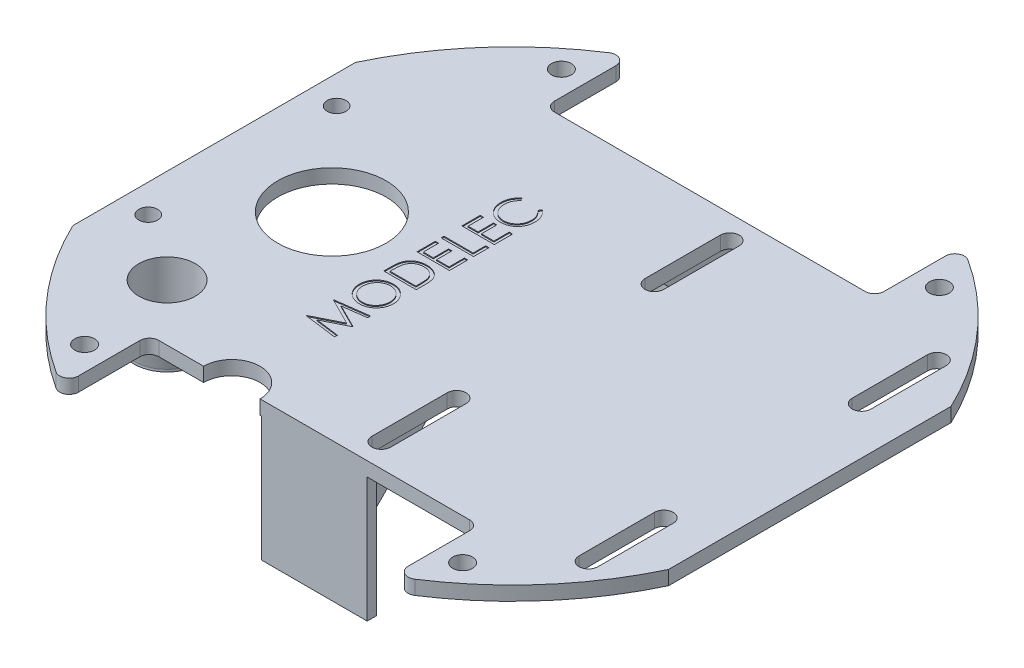
from build123d import *

# Parameters (mm, degrees)
ESQUISSE1_R                  = 2.1
ESQUISSE1_R_2                = 11.5
BOSS_EXTRU_1_DEPTH           = 3
CONG_1_R                     = 2
ESQUISSE5_W                  = 22.5
ESQUISSE5_H                  = 2
BOSS_EXTRU_2_DEPTH           = 26.5
ESQUISSE6_W                  = 3
ESQUISSE6_H                  = 15
BOSS_EXTRU_3_DEPTH           = 15
CHANFREIN1_SIZE              = 15
CHANFREIN1_OF_SYM_TRIE3_SIZE = 15
ENL_V_MAT_EXTRU_2_DEPTH      = 0.2
ESQUISSE8_OUTSIDE_W          = 163.602
ESQUISSE8_OUTSIDE_H          = 155.216
ESQUISSE8_OUTSIDE_R          = 6
ENL_V_MAT_EXTRU_3_DEPTH      = 92.419147085
ESQUISSE9_R                  = 7
ESQUISSE9_R_2                = 6
BOSS_EXTRU_4_DEPTH           = 9
CHANFREIN2_SIZE              = 1.5
CHANFREIN2_SIZE2             = 8.506922729
ESQUISSE10_OUTSIDE_W         = 163.602
ESQUISSE10_OUTSIDE_H         = 155.216
ESQUISSE10_OUTSIDE_R         = 2
ENL_V_MAT_EXTRU_4_DEPTH      = 9


with BuildPart() as part:
    # Esquisse1 → Boss.-Extru.1 (new body)
    with BuildSketch(Plane(origin=(0, 0, 0), x_dir=(1, 0, 0), z_dir=(0, 1, 0))):
        with BuildLine():
            Line((35, 60.621778265), (35, 42))
            Line((35, 42), (-35, 42))
            Line((-35, 42), (-35, 60.621778265))
            ThreePointArc((-35, 60.621778265), (-51.453576232, 47.460820609), (-63.245553203, 30))
            Line((-63.245553203, 30), (-63.245553203, -30))
            ThreePointArc((-63.245553203, -30), (-51.453576232, -47.460820609), (-35, -60.621778265))
            Line((-35, -60.621778265), (-35, -42))
            Line((-35, -42), (-23.5, -42))
            ThreePointArc((-23.5, -42), (-17.5, -36), (-11.5, -42))
            Line((-11.5, -42), (35, -42))
            Line((35, -42), (35, -60.621778265))
            ThreePointArc((35, -60.621778265), (51.453576232, -47.460820609), (63.245553203, -30))
            Line((63.245553203, -30), (63.245553203, 30))
            ThreePointArc((63.245553203, 30), (51.453576232, 47.460820609), (35, 60.621778265))
        make_face()
        with Locations(Location((-40.134685529, -50.621778265, 0), (0, 0, 270))):
            Circle(ESQUISSE1_R, mode=Mode.SUBTRACT)
        with Locations(Location((-38.245553203, 0, 0), (0, 0, 270))):
            Circle(ESQUISSE1_R_2, mode=Mode.SUBTRACT)
        with Locations(Location((40.134685529, -50.621778265, 0), (0, 0, 270))):
            Circle(ESQUISSE1_R, mode=Mode.SUBTRACT)
        with BuildLine():
            ThreePointArc((7.245553203, -21), (9.245553203, -19), (11.245553203, -21))
            Line((11.245553203, -21), (11.245553203, -37))
            ThreePointArc((11.245553203, -37), (9.245553203, -39), (7.245553203, -37))
            Line((7.245553203, -37), (7.245553203, -21))
        make_face(mode=Mode.SUBTRACT)
        with BuildLine():
            Line((51.245553203, -37), (51.245553203, -21))
            ThreePointArc((51.245553203, -21), (53.245553203, -19), (55.245553203, -21))
            Line((55.245553203, -21), (55.245553203, -37))
            ThreePointArc((55.245553203, -37), (53.245553203, -39), (51.245553203, -37))
        make_face(mode=Mode.SUBTRACT)
        with Locations(Location((-40.134685529, 50.621778265, 0), (0, 0, 270))):
            Circle(ESQUISSE1_R, mode=Mode.SUBTRACT)
        with BuildLine():
            ThreePointArc((7.245553203, 37), (9.245553203, 39), (11.245553203, 37))
            Line((11.245553203, 37), (11.245553203, 21))
            ThreePointArc((11.245553203, 21), (9.245553203, 19), (7.245553203, 21))
            Line((7.245553203, 21), (7.245553203, 37))
        make_face(mode=Mode.SUBTRACT)
        with BuildLine():
            Line((51.245553203, 21), (51.245553203, 37))
            ThreePointArc((51.245553203, 37), (53.245553203, 39), (55.245553203, 37))
            Line((55.245553203, 37), (55.245553203, 21))
            ThreePointArc((55.245553203, 21), (53.245553203, 19), (51.245553203, 21))
        make_face(mode=Mode.SUBTRACT)
        with Locations(Location((40.134685529, 50.621778265, 0), (0, 0, 270))):
            Circle(ESQUISSE1_R, mode=Mode.SUBTRACT)
    extrude(amount=BOSS_EXTRU_1_DEPTH)

    # Congé1
    cong_1_edges = [part.edges().sort_by_distance(p)[0] for p in [
        (-35, 1.5, 42),
        (-35, 1.5, 60.621778265),
        (-35, 1.5, -60.621778265),
        (-35, 1.5, -42),
        (35, 1.5, -42),
        (35, 1.5, -60.621778265),
        (35, 1.5, 60.621778265),
        (35, 1.5, 42),
    ]]
    fillet(cong_1_edges, radius=CONG_1_R)

    # Esquisse5 → Boss.-Extru.2 (add)
    with BuildSketch(Plane.XZ):
        with Locations((0, 41)):
            Rectangle(ESQUISSE5_W, ESQUISSE5_H)
        with Locations((0, -41)):
            Rectangle(ESQUISSE5_W, ESQUISSE5_H)
    extrude(amount=BOSS_EXTRU_2_DEPTH)

    # Esquisse6 → Boss.-Extru.3 (add)
    with BuildSketch(Plane(origin=(0, 0, 40), x_dir=(-1, 0, 0), z_dir=(0, 0, -1))):
        with Locations((5.5, -7.5)):
            Rectangle(ESQUISSE6_W, ESQUISSE6_H)
        with Locations((-5.5, -7.5)):
            Rectangle(ESQUISSE6_W, ESQUISSE6_H)
    boss_extru_3 = extrude(amount=BOSS_EXTRU_3_DEPTH)

    # Chanfrein1
    chanfrein1_edges = [part.edges().sort_by_distance(p)[0] for p in [
        (-5.5, -15, 25),
        (5.5, -15, 25),
    ]]
    chamfer(chanfrein1_edges, length=CHANFREIN1_SIZE - 0.0001)  # a hair under: the kernel refuses the full size

    # Symétrie3: Boss.-Extru.3 across plane
    add(boss_extru_3.mirror(Plane.XY))

    # Chanfrein1 of Symétrie3
    chanfrein1_of_sym_trie3_edges = [part.edges().sort_by_distance(p)[0] for p in [
        (-5.5, -15, -25),
        (5.5, -15, -25),
    ]]
    chamfer(chanfrein1_of_sym_trie3_edges, length=CHANFREIN1_OF_SYM_TRIE3_SIZE - 0.0001)  # a hair under: the kernel refuses the full size

    # Esquisse7 → Enlèv. mat.-Extru.2 (cut)
    # profile 1 of 7: a face of its own
    with BuildSketch(Plane(origin=(0, 3, 0), x_dir=(1, 0, 0), z_dir=(0, 1, 0))):
        with BuildLine():
            Line((-20.616883681, 22.710069444), (-20.203472222, 22.169878472))
            add(Edge.make_bspline(
                [(-20.203472222, 22.169878472), (-20.249396872, 22.13134317), (-20.340627008, 22.054792106), (-20.468744777, 21.931642741), (-20.588733703, 21.803272199), (-20.701364729, 21.66985909), (-20.802110982, 21.528315928), (-20.898818665, 21.384035904), (-20.983489569, 21.231776687), (-21.08692567, 21.022300434), (-21.192507792, 20.747201267), (-21.283317532, 20.40209344), (-21.340580065, 20.041338504), (-21.346824055, 19.795275009), (-21.35, 19.670117188)],
                knots=[0, 0, 0, 0, 0.75789156, 1.505565099, 2.245254514, 2.979266606, 3.711207489, 4.440978832, 5.174393176, 5.91211879, 7.394186119, 8.890401545, 10.418332761, 12, 12, 12, 12], degree=3))
            add(Edge.make_bspline(
                [(-21.35, 19.670117188), (-21.349206021, 19.601161798), (-21.347625433, 19.46389099), (-21.32677345, 19.260172383), (-21.297465822, 19.060257803), (-21.253979025, 18.864277291), (-21.19899951, 18.672480307), (-21.133302649, 18.483612987), (-21.052020719, 18.30040974), (-20.962182133, 18.120336395), (-20.86070995, 17.947808), (-20.7500262, 17.784566895), (-20.631376545, 17.631198901), (-20.504290298, 17.487617673), (-20.369435334, 17.353547645), (-20.225300834, 17.230675892), (-20.073427639, 17.117360755), (-19.913689628, 17.014248038), (-19.747574513, 16.921422647), (-19.574133877, 16.843370927), (-19.396337374, 16.775201083), (-19.212924552, 16.720410217), (-19.025114469, 16.677379193), (-18.83212908, 16.647629523), (-18.634334274, 16.627019199), (-18.500270727, 16.625445855), (-18.432693142, 16.624652778)],
                knots=[0, 0, 0, 0, 1.054877232, 2.099964208, 3.13098259, 4.145888998, 5.169474743, 6.183358035, 7.203388855, 8.234598956, 9.261847606, 10.264062591, 11.251197969, 12.227332808, 13.196685059, 14.158975844, 15.123498106, 16.094582253, 17.066912473, 18.032714859, 19.002806091, 19.979168736, 20.95977404, 21.949109834, 22.966205168, 24, 24, 24, 24], degree=3))
            add(Edge.make_bspline(
                [(-18.432693142, 16.624652778), (-18.331018731, 16.627138668), (-18.131394512, 16.632019385), (-17.838957243, 16.675272308), (-17.558533207, 16.741527313), (-17.292021127, 16.839199767), (-17.037199304, 16.962038376), (-16.797157973, 17.115307089), (-16.568380458, 17.293490958), (-16.356407619, 17.498417922), (-16.162783975, 17.723285776), (-15.992277047, 17.964542298), (-15.850144059, 18.221596118), (-15.731869617, 18.491606502), (-15.640953134, 18.776651907), (-15.576949121, 19.076219563), (-15.535198122, 19.389657975), (-15.531200956, 19.603834736), (-15.529166667, 19.712836372)],
                knots=[0, 0, 0, 0, 1.029159485, 2.020618137, 2.987588728, 3.942669054, 4.889339625, 5.846988364, 6.821327795, 7.821533711, 8.827683044, 9.822769455, 10.807800696, 11.797391277, 12.803701919, 13.832062008, 14.896664671, 16, 16, 16, 16], degree=3))
            add(Edge.make_bspline(
                [(-15.529166667, 19.712836372), (-15.532485923, 19.832932252), (-15.539019014, 20.069309674), (-15.594365347, 20.41595683), (-15.684104898, 20.747799508), (-15.809694743, 21.064855556), (-15.972957588, 21.366231152), (-16.170876869, 21.652397921), (-16.405335247, 21.923597413), (-16.584356967, 22.086675493), (-16.675694444, 22.169878472)],
                knots=[0, 0, 0, 0, 1.028121516, 2.023589091, 2.998037872, 3.967518031, 4.937445131, 5.927275754, 6.942489185, 8, 8, 8, 8], degree=3))
            Line((-16.675694444, 22.169878472), (-16.266417101, 22.710069444))
            add(Edge.make_bspline(
                [(-16.266417101, 22.710069444), (-16.210327394, 22.666595302), (-16.098416647, 22.579855255), (-15.940615723, 22.439428832), (-15.792321891, 22.291388641), (-15.654275726, 22.13535416), (-15.525905833, 21.971050367), (-15.40714248, 21.79849234), (-15.298615945, 21.617827373), (-15.198928994, 21.430490468), (-15.111158014, 21.236049944), (-15.033380103, 21.036217545), (-14.968988584, 20.829768015), (-14.914520585, 20.618439203), (-14.87568245, 20.400322508), (-14.844754803, 20.177953377), (-14.826406231, 19.949250511), (-14.824551176, 19.795091746), (-14.823611111, 19.716970486)],
                knots=[0, 0, 0, 0, 0.986911346, 1.969095443, 2.935967484, 3.900112155, 4.865124501, 5.834589912, 6.812044781, 7.795288262, 8.784678562, 9.777857908, 10.776141921, 11.791195789, 12.811324908, 13.855933174, 14.913475973, 16, 16, 16, 16], degree=3))
            add(Edge.make_bspline(
                [(-14.823611111, 19.716970486), (-14.824126051, 19.642982755), (-14.825144282, 19.496681178), (-14.841638887, 19.280677799), (-14.864143072, 19.070392325), (-14.898028139, 18.866425769), (-14.938014455, 18.667665072), (-14.991615461, 18.475912066), (-15.05165912, 18.289279861), (-15.122229517, 18.108518277), (-15.201863109, 17.933473558), (-15.291865328, 17.764710281), (-15.391479326, 17.602306064), (-15.498509353, 17.444664219), (-15.616393311, 17.294113492), (-15.743494042, 17.149349242), (-15.879383156, 17.009559708), (-15.977371683, 16.923073479), (-16.026638455, 16.879589844)],
                knots=[0, 0, 0, 0, 1.114604814, 2.203992996, 3.262667896, 4.300477797, 5.318619304, 6.316056647, 7.298880507, 8.271930387, 9.238335007, 10.195173496, 11.151986948, 12.108099108, 13.064862484, 14.031167946, 15.010108607, 16, 16, 16, 16], degree=3))
            add(Edge.make_bspline(
                [(-16.026638455, 16.879589844), (-16.11221939, 16.809946473), (-16.282348054, 16.671500527), (-16.558050816, 16.494293757), (-16.845651534, 16.343111464), (-17.146816042, 16.219510494), (-17.461661416, 16.12457053), (-17.789681162, 16.057821563), (-18.130219551, 16.014748557), (-18.36182169, 16.009804673), (-18.479546441, 16.007291667)],
                knots=[0, 0, 0, 0, 0.994611881, 1.977215934, 2.950189954, 3.921972279, 4.908960509, 5.911694611, 6.938501887, 8, 8, 8, 8], degree=3))
            add(Edge.make_bspline(
                [(-18.479546441, 16.007291667), (-18.603283886, 16.010348363), (-18.846729584, 16.016362221), (-19.204001961, 16.067456338), (-19.546292389, 16.149650186), (-19.872961892, 16.266393357), (-20.185728669, 16.414404232), (-20.482203466, 16.597245826), (-20.764282318, 16.812793983), (-21.027685121, 17.05935819), (-21.268533301, 17.329743513), (-21.480423828, 17.619295134), (-21.656761469, 17.927446318), (-21.804164641, 18.250802238), (-21.917463461, 18.591784214), (-21.996776689, 18.949664741), (-22.046143783, 19.323771346), (-22.052384578, 19.579012852), (-22.055555556, 19.708702257)],
                knots=[0, 0, 0, 0, 1.032925535, 2.032216505, 3.007276963, 3.968222605, 4.92396291, 5.891752235, 6.871517503, 7.883894988, 8.900124299, 9.891468569, 10.874487609, 11.85992873, 12.854644235, 13.869047385, 14.917252991, 16, 16, 16, 16], degree=3))
            add(Edge.make_bspline(
                [(-22.055555556, 19.708702257), (-22.0546071, 19.787742585), (-22.052729729, 19.944194954), (-22.034450674, 20.175638746), (-22.003915132, 20.400951694), (-21.962572012, 20.62037076), (-21.910508695, 20.834530299), (-21.845621125, 21.043029653), (-21.768367913, 21.245358261), (-21.680148326, 21.441450393), (-21.580945904, 21.629982318), (-21.471930771, 21.810835679), (-21.353653751, 21.983289463), (-21.224903954, 22.146447329), (-21.086749346, 22.300508897), (-20.940808216, 22.447759529), (-20.783335602, 22.583912899), (-20.672469221, 22.667940284), (-20.616883681, 22.710069444)],
                knots=[0, 0, 0, 0, 1.096622143, 2.170653093, 3.219033441, 4.250379162, 5.267604342, 6.275621678, 7.278284436, 8.271072515, 9.257558938, 10.232633088, 11.19973724, 12.157384997, 13.114417402, 14.069920322, 15.032307892, 16, 16, 16, 16], degree=3))
        make_face()
    # profile 2 of 7: a face of its own
    with BuildSketch(Plane(origin=(0, 3, 0), x_dir=(1, 0, 0), z_dir=(0, 1, 0))):
        Polygon((-21.879166667, 11.244791667), (-21.879166667, 15.125347222), (-21.173611111, 15.125347222), (-21.173611111, 11.862152778), (-19.056944444, 11.862152778), (-19.056944444, 15.125347222), (-18.351388889, 15.125347222), (-18.351388889, 11.862152778), (-15.705555556, 11.862152778), (-15.705555556, 15.125347222), (-15, 15.125347222), (-15, 11.244791667), align=None)
    # profile 3 of 7: a face of its own
    with BuildSketch(Plane(origin=(0, 3, 0), x_dir=(1, 0, 0), z_dir=(0, 1, 0))):
        Polygon((-21.879166667, 6.835069444), (-21.879166667, 7.452430556), (-15.705555556, 7.452430556), (-15.705555556, 10.098263889), (-15, 10.098263889), (-15, 6.835069444), align=None)
    # profile 4 of 7: a face of its own
    with BuildSketch(Plane(origin=(0, 3, 0), x_dir=(1, 0, 0), z_dir=(0, 1, 0))):
        Polygon((-21.879166667, 1.719791667), (-21.879166667, 5.600347222), (-21.173611111, 5.600347222), (-21.173611111, 2.337152778), (-19.056944444, 2.337152778), (-19.056944444, 5.600347222), (-18.351388889, 5.600347222), (-18.351388889, 2.337152778), (-15.705555556, 2.337152778), (-15.705555556, 5.600347222), (-15, 5.600347222), (-15, 1.719791667), align=None)
    # profile 5 of 7: a face of its own
    with BuildSketch(Plane(origin=(0, 3, 0), x_dir=(1, 0, 0), z_dir=(0, 1, 0))):
        with BuildLine():
            Line((-15, -5.335763889), (-21.879166667, -5.335763889))
            Line((-21.879166667, -5.335763889), (-21.879166667, -3.946701389))
            add(Edge.make_bspline(
                [(-21.879166667, -3.946701389), (-21.878296806, -3.825885556), (-21.876616239, -3.592469996), (-21.865960624, -3.255169817), (-21.847110792, -2.943084112), (-21.819654021, -2.65723929), (-21.785940142, -2.396850622), (-21.743681609, -2.162647215), (-21.693781764, -1.953418063), (-21.651238147, -1.824739436), (-21.631119792, -1.763888889)],
                knots=[0, 0, 0, 0, 1.314313732, 2.53924729, 3.670748893, 4.714932338, 5.66265055, 6.526160246, 7.303039223, 8, 8, 8, 8], degree=3))
            add(Edge.make_bspline(
                [(-21.631119792, -1.763888889), (-21.600800552, -1.684290275), (-21.540849612, -1.526898079), (-21.427586962, -1.302923854), (-21.299782561, -1.091358635), (-21.154495277, -0.893889208), (-20.993622318, -0.710020099), (-20.818312957, -0.53766445), (-20.624672774, -0.38107169), (-20.416148447, -0.237802887), (-20.195411762, -0.108592607), (-19.962824227, 0.003710776), (-19.719583114, 0.096981087), (-19.466360497, 0.174407367), (-19.202600768, 0.235428487), (-18.927996475, 0.277061057), (-18.643632977, 0.304520708), (-18.450673406, 0.307280337), (-18.352766927, 0.308680556)],
                knots=[0, 0, 0, 0, 0.984741985, 1.947153288, 2.898543998, 3.841229145, 4.778974371, 5.722123648, 6.681464302, 7.655713756, 8.646344578, 9.637374342, 10.639946623, 11.656849581, 12.698333139, 13.76849723, 14.867749466, 16, 16, 16, 16], degree=3))
            add(Edge.make_bspline(
                [(-18.352766927, 0.308680556), (-18.267737994, 0.307444334), (-18.100179599, 0.30500823), (-17.853235399, 0.283133839), (-17.613617218, 0.251339617), (-17.382465868, 0.202116024), (-17.157757012, 0.142359948), (-16.941882391, 0.065779253), (-16.732873349, -0.021959611), (-16.533513299, -0.124229828), (-16.344759684, -0.236658218), (-16.166692319, -0.356559723), (-16.003262577, -0.486653616), (-15.850187859, -0.623089512), (-15.711557382, -0.769157544), (-15.584844099, -0.923079354), (-15.472169467, -1.085453125), (-15.37176291, -1.257283996), (-15.281972105, -1.440866812), (-15.2070758, -1.64197618), (-15.142207954, -1.859659488), (-15.090605579, -2.095158128), (-15.048987894, -2.347632147), (-15.021278679, -2.617781916), (-15.002486597, -2.905096887), (-15.00084496, -3.102390625), (-15, -3.203938802)],
                knots=[0, 0, 0, 0, 1.106010661, 2.179509527, 3.223302912, 4.248870533, 5.252098245, 6.246278179, 7.226402005, 8.199283979, 9.158616973, 10.083547221, 10.989831858, 11.874256832, 12.749262829, 13.607058236, 14.46581075, 15.317568432, 16.194266721, 17.121067875, 18.106207572, 19.147242834, 20.255495536, 21.43354536, 22.679031616, 24, 24, 24, 24], degree=3))
            Line((-15, -3.203938802), (-15, -5.335763889))
        make_face()
        with BuildLine():
            Line((-15.705555556, -4.718402778), (-15.705555556, -3.928786892))
            add(Edge.make_bspline(
                [(-15.705555556, -3.928786892), (-15.706043183, -3.815323154), (-15.706981069, -3.597090833), (-15.715210917, -3.28328684), (-15.728658583, -2.99656436), (-15.74747817, -2.736882679), (-15.772378032, -2.504388418), (-15.800140192, -2.298595691), (-15.834727562, -2.120179082), (-15.866078793, -2.012216581), (-15.880566406, -1.962326389)],
                knots=[0, 0, 0, 0, 1.375205317, 2.645023457, 3.804390687, 4.853969522, 5.800190428, 6.637939096, 7.370582563, 8, 8, 8, 8], degree=3))
            add(Edge.make_bspline(
                [(-15.880566406, -1.962326389), (-15.902681072, -1.899532637), (-15.946382195, -1.775444962), (-16.026097372, -1.596820447), (-16.120522696, -1.430232225), (-16.225484398, -1.272779149), (-16.344679671, -1.126687129), (-16.475534634, -0.990253514), (-16.618647133, -0.863645339), (-16.773785105, -0.748812713), (-16.939266266, -0.644800781), (-17.115383282, -0.5555109), (-17.299660213, -0.477751112), (-17.493588886, -0.416179442), (-17.695747907, -0.367632877), (-17.907185558, -0.333604449), (-18.12771474, -0.312479087), (-18.277845281, -0.309960538), (-18.354144965, -0.308680556)],
                knots=[0, 0, 0, 0, 0.998590647, 1.973329978, 2.929871262, 3.868367705, 4.809062953, 5.754642869, 6.701828697, 7.672172887, 8.647399344, 9.630604387, 10.631475358, 11.644913558, 12.679592956, 13.747988925, 14.855477812, 16, 16, 16, 16], degree=3))
            add(Edge.make_bspline(
                [(-18.354144965, -0.308680556), (-18.434598746, -0.30968941), (-18.592650911, -0.311671312), (-18.824558813, -0.336582368), (-19.04760233, -0.372986044), (-19.261796378, -0.425628741), (-19.467558842, -0.492712171), (-19.663751712, -0.576430925), (-19.852446996, -0.672084007), (-20.02928947, -0.785891637), (-20.19653795, -0.910533476), (-20.34975648, -1.048859522), (-20.489294087, -1.198672124), (-20.617323855, -1.358337286), (-20.728694961, -1.532354847), (-20.828318426, -1.716625494), (-20.912865136, -1.913852521), (-20.957832996, -2.051067713), (-20.980685764, -2.120800781)],
                knots=[0, 0, 0, 0, 1.122418816, 2.205001699, 3.251619955, 4.274784885, 5.280384055, 6.268708349, 7.249350384, 8.229342522, 9.199999885, 10.157847722, 11.105861043, 12.055065948, 13.010012805, 13.98527497, 14.976112212, 16, 16, 16, 16], degree=3))
            add(Edge.make_bspline(
                [(-20.980685764, -2.120800781), (-20.99663841, -2.178489761), (-21.030558111, -2.301152359), (-21.067558933, -2.501315401), (-21.10019468, -2.726588748), (-21.127825422, -2.977972565), (-21.147651812, -3.255180299), (-21.16253305, -3.558425145), (-21.172570015, -3.887838177), (-21.173255391, -4.116192181), (-21.173611111, -4.234711372)],
                knots=[0, 0, 0, 0, 0.674548936, 1.434276114, 2.292660221, 3.240891867, 4.284742987, 5.42552168, 6.663806718, 8, 8, 8, 8], degree=3))
            Line((-21.173611111, -4.234711372), (-21.173611111, -4.718402778))
            Line((-21.173611111, -4.718402778), (-15.705555556, -4.718402778))
        make_face(mode=Mode.SUBTRACT)
    # profile 6 of 7: a face of its own
    with BuildSketch(Plane(origin=(0, 3, 0), x_dir=(1, 0, 0), z_dir=(0, 1, 0))):
        with BuildLine():
            add(Edge.make_bspline(
                [(-22.055555556, -10.406944444), (-22.05238358, -10.279551767), (-22.046153558, -10.029342038), (-21.996889317, -9.661952237), (-21.915805531, -9.310160029), (-21.801297911, -8.973763173), (-21.652853171, -8.65404107), (-21.472535323, -8.350090739), (-21.259248542, -8.062823089), (-21.016124741, -7.7942155), (-20.749864499, -7.549183151), (-20.464827861, -7.334165992), (-20.164598489, -7.152778727), (-19.849160724, -7.004293495), (-19.519251024, -6.887722746), (-19.173020416, -6.807302996), (-18.812736604, -6.755927539), (-18.566999124, -6.749921694), (-18.44233941, -6.746875)],
                knots=[0, 0, 0, 0, 1.065064174, 2.09187391, 3.093564831, 4.079973196, 5.057907931, 6.036227367, 7.030399151, 8.044883615, 9.061699972, 10.052012555, 11.025713132, 11.989727027, 12.962874294, 13.945865945, 14.957962116, 16, 16, 16, 16], degree=3))
            add(Edge.make_bspline(
                [(-18.44233941, -6.746875), (-18.318598689, -6.749922719), (-18.074691394, -6.755930128), (-17.716683595, -6.807344682), (-17.372580764, -6.888081583), (-17.043149862, -7.00285019), (-16.728352763, -7.151449363), (-16.427896107, -7.333103658), (-16.142098135, -7.547712738), (-15.874003578, -7.791704555), (-15.62875913, -8.058472026), (-15.412443975, -8.342413186), (-15.23097775, -8.642634553), (-15.080834814, -8.956024945), (-14.966693383, -9.285045204), (-14.883594653, -9.627301045), (-14.832729209, -9.98465719), (-14.826683829, -10.228091341), (-14.823611111, -10.351822917)],
                knots=[0, 0, 0, 0, 1.043748596, 2.057349401, 3.045489418, 4.02252776, 4.995289225, 5.97782527, 6.980224157, 8.006516136, 9.032559198, 10.034193337, 11.013412982, 11.987833483, 12.961212594, 13.946489799, 14.956251404, 16, 16, 16, 16], degree=3))
            add(Edge.make_bspline(
                [(-14.823611111, -10.351822917), (-14.826656394, -10.476481906), (-14.832659457, -10.722217956), (-14.884118385, -11.082955629), (-14.964587543, -11.429425338), (-15.079586447, -11.760636283), (-15.228210313, -12.076773162), (-15.409435825, -12.378454265), (-15.624472956, -12.664468684), (-15.868519402, -12.932445141), (-16.134195869, -13.17763672), (-16.418864149, -13.391400683), (-16.716939338, -13.572666948), (-17.029248639, -13.720791783), (-17.354282272, -13.838060857), (-17.694208387, -13.918065208), (-18.047089011, -13.969827895), (-18.287354517, -13.975792814), (-18.409266493, -13.978819444)],
                knots=[0, 0, 0, 0, 1.053102029, 2.075944431, 3.073151272, 4.055350789, 5.033113405, 6.020478099, 7.024410459, 8.052272461, 9.079885166, 10.07527673, 11.055994387, 12.023226415, 12.992069828, 13.970394897, 14.97016774, 16, 16, 16, 16], degree=3))
            add(Edge.make_bspline(
                [(-18.409266493, -13.978819444), (-18.491094513, -13.977768631), (-18.653718256, -13.975680261), (-18.895209633, -13.950538494), (-19.132817342, -13.914055912), (-19.365865718, -13.861770486), (-19.593784272, -13.793388293), (-19.818144878, -13.712701511), (-20.03667384, -13.614152839), (-20.250406388, -13.502748374), (-20.456010736, -13.378408797), (-20.650356202, -13.241069675), (-20.835073614, -13.095554921), (-21.005376237, -12.936030203), (-21.16621834, -12.767753119), (-21.315128156, -12.587993854), (-21.453448447, -12.397849276), (-21.578099617, -12.196501218), (-21.690837631, -11.988911013), (-21.787582007, -11.774916299), (-21.870615635, -11.557423442), (-21.937915162, -11.335413771), (-21.991045985, -11.109476835), (-22.0272252, -10.879119518), (-22.052431092, -10.644525338), (-22.054509587, -10.486478805), (-22.055555556, -10.406944444)],
                knots=[0, 0, 0, 0, 1.037015668, 2.060948919, 3.074880161, 4.083647147, 5.086022904, 6.090072063, 7.104153813, 8.122640571, 9.144368836, 10.147691507, 11.138137339, 12.123020368, 13.103399296, 14.087645067, 15.080126199, 16.082011238, 17.087798457, 18.072939717, 19.057185487, 20.037253025, 21.01195951, 21.997135196, 22.992090687, 24, 24, 24, 24], degree=3))
        make_face()
        with BuildLine():
            add(Edge.make_bspline(
                [(-21.35, -10.376627604), (-21.349206973, -10.44191101), (-21.347628501, -10.571853709), (-21.326722529, -10.765017282), (-21.297139604, -10.955699094), (-21.254174822, -11.143530151), (-21.198601743, -11.328904369), (-21.131576224, -11.511904048), (-21.050565839, -11.691901742), (-20.959459819, -11.868672582), (-20.855977954, -12.038133742), (-20.746090321, -12.200693333), (-20.625713998, -12.352123042), (-20.497452307, -12.494503089), (-20.360192135, -12.62747939), (-20.214834886, -12.75099329), (-20.060751851, -12.864943503), (-19.898577146, -12.967958687), (-19.729216228, -13.059634159), (-19.555906548, -13.141715053), (-19.376611356, -13.209756982), (-19.19244951, -13.263656327), (-19.004232569, -13.309404522), (-18.810935059, -13.338101175), (-18.613223345, -13.359213135), (-18.479605869, -13.360704172), (-18.412022569, -13.361458333)],
                knots=[0, 0, 0, 0, 1.008406545, 2.007172654, 2.999155034, 3.989332444, 4.982025741, 5.988181096, 6.998684226, 8.030553839, 9.059268815, 10.065399129, 11.060956322, 12.046057109, 13.024974577, 14.012068307, 14.991706172, 15.984221787, 16.978487447, 17.966117052, 18.945677757, 19.938371053, 20.93015022, 21.936155317, 22.956113857, 24, 24, 24, 24], degree=3))
            add(Edge.make_bspline(
                [(-18.412022569, -13.361458333), (-18.312645988, -13.35894689), (-18.117141508, -13.354006103), (-17.830605455, -13.310930817), (-17.554964078, -13.244052181), (-17.291860307, -13.147090792), (-17.040120891, -13.023397408), (-16.800725507, -12.872516591), (-16.573744776, -12.69306659), (-16.360868342, -12.489347041), (-16.166644938, -12.266585084), (-15.995921546, -12.030158042), (-15.852235978, -11.78193644), (-15.732118071, -11.523350961), (-15.641626238, -11.252193848), (-15.577105603, -10.970203656), (-15.535287946, -10.677374152), (-15.531226457, -10.477827816), (-15.529166667, -10.376627604)],
                knots=[0, 0, 0, 0, 1.032022337, 2.030307203, 3.003823408, 3.974715386, 4.937372378, 5.913284036, 6.909147208, 7.938749767, 8.970518239, 9.975863271, 10.963918693, 11.946286286, 12.933361397, 13.927862637, 14.949112547, 16, 16, 16, 16], degree=3))
            add(Edge.make_bspline(
                [(-15.529166667, -10.376627604), (-15.530100505, -10.308603185), (-15.531952587, -10.173690332), (-15.55063306, -9.973027936), (-15.580529469, -9.775962017), (-15.623786759, -9.582856685), (-15.677209081, -9.39345893), (-15.743473965, -9.208340233), (-15.822909678, -9.027562079), (-15.911438153, -8.850235542), (-16.012004113, -8.680331133), (-16.12041036, -8.518757593), (-16.238662687, -8.367588774), (-16.365201769, -8.225275529), (-16.502040004, -8.093231167), (-16.646513863, -7.970068936), (-16.800923923, -7.858088955), (-16.962434399, -7.755422995), (-17.130560573, -7.662628941), (-17.304346719, -7.58292226), (-17.482860762, -7.514851105), (-17.666233861, -7.459978043), (-17.854053534, -7.416957355), (-18.046588591, -7.38731958), (-18.243449182, -7.366586483), (-18.376598147, -7.365023831), (-18.443717448, -7.364236111)],
                knots=[0, 0, 0, 0, 1.047334373, 2.07717862, 3.100662057, 4.115010574, 5.122652213, 6.129548646, 7.140165612, 8.16200981, 9.179904151, 10.178566626, 11.156366481, 12.133321541, 13.108841334, 14.082538371, 15.054589433, 16.043660176, 17.028268541, 18.009491307, 18.985652105, 19.968123554, 20.954864208, 21.950389976, 22.966808393, 24, 24, 24, 24], degree=3))
            add(Edge.make_bspline(
                [(-18.443717448, -7.364236111), (-18.510377564, -7.365024489), (-18.642610184, -7.366588382), (-18.838098054, -7.387309365), (-19.029246926, -7.416989805), (-19.215306376, -7.45976389), (-19.396323837, -7.514895798), (-19.572129279, -7.582876379), (-19.743377713, -7.663038887), (-19.909645635, -7.755039443), (-20.069193227, -7.858454197), (-20.221716779, -7.971459224), (-20.364364768, -8.095996858), (-20.50061056, -8.228541485), (-20.627728958, -8.372279766), (-20.745228796, -8.527236787), (-20.858404225, -8.68955432), (-20.958565734, -8.862903055), (-21.051527835, -9.041163428), (-21.130838776, -9.224246831), (-21.198955641, -9.409538566), (-21.254340719, -9.597779462), (-21.296975028, -9.788880542), (-21.326749003, -9.982730674), (-21.347621321, -10.17865321), (-21.349204591, -10.310426726), (-21.35, -10.376627604)],
                knots=[0, 0, 0, 0, 1.029877221, 2.042951179, 3.035109885, 4.018542222, 4.991021277, 5.957494829, 6.929429462, 7.911425532, 8.892163142, 9.866273635, 10.842761649, 11.81676864, 12.802607151, 13.805177466, 14.821356543, 15.858816981, 16.897175917, 17.927346774, 18.940346092, 19.946830556, 20.957962087, 21.964146003, 22.97721996, 24, 24, 24, 24], degree=3))
        make_face(mode=Mode.SUBTRACT)
    # profile 7 of 7: a face of its own
    with BuildSketch(Plane(origin=(0, 3, 0), x_dir=(1, 0, 0), z_dir=(0, 1, 0))):
        Polygon((-15, -22.710069444), (-21.879166667, -21.801942274), (-21.879166667, -21.71374783), (-16.234722222, -18.873611111), (-21.879166667, -16.040364583), (-21.879166667, -15.950792101), (-15, -15.037152778), (-15, -15.657269965), (-19.949913194, -16.315972222), (-15, -18.799197049), (-15, -18.938378906), (-19.9609375, -21.43125), (-15, -22.088574219), align=None)
    extrude(amount=-ENL_V_MAT_EXTRU_2_DEPTH, mode=Mode.SUBTRACT)

    # Esquisse8 outside → Enlèv. mat.-Extru.3 (cut, through all)
    # profile 1 of 2: a face of its own
    with BuildSketch(Plane(origin=(0, 3, 0), x_dir=(1, 0, 0), z_dir=(0, 1, 0))):
        Rectangle(ESQUISSE8_OUTSIDE_W, ESQUISSE8_OUTSIDE_H)
        with BuildLine():
            Line((35, 57.052607302), (35, 44))
            ThreePointArc((35, 44), (34.414213562, 42.585786438), (33, 42))
            Line((33, 42), (-33, 42))
            ThreePointArc((-33, 42), (-34.414213562, 42.585786438), (-35, 44))
            Line((-35, 44), (-35, 57.052607302))
            ThreePointArc((-35, 57.052607302), (-36.045136289, 58.809944861), (-38.088235294, 58.730625164))
            ThreePointArc((-38.088235294, 58.730625164), (-52.663995086, 46.114028469), (-63.245553203, 30))
            Line((-63.245553203, 30), (-63.245553203, -30))
            ThreePointArc((-63.245553203, -30), (-52.663995086, -46.114028469), (-38.088235294, -58.730625164))
            ThreePointArc((-38.088235294, -58.730625164), (-36.045136289, -58.809944861), (-35, -57.052607302))
            Line((-35, -57.052607302), (-35, -44))
            ThreePointArc((-35, -44), (-34.414213562, -42.585786438), (-33, -42))
            Line((-33, -42), (-23.5, -42))
            ThreePointArc((-23.5, -42), (-17.5, -36), (-11.5, -42))
            Line((-11.5, -42), (33, -42))
            ThreePointArc((33, -42), (34.414213562, -42.585786438), (35, -44))
            Line((35, -44), (35, -57.052607302))
            ThreePointArc((35, -57.052607302), (36.045136289, -58.809944861), (38.088235294, -58.730625164))
            ThreePointArc((38.088235294, -58.730625164), (52.663995086, -46.114028469), (63.245553203, -30))
            Line((63.245553203, -30), (63.245553203, 30))
            ThreePointArc((63.245553203, 30), (52.663995086, 46.114028469), (38.088235294, 58.730625164))
            ThreePointArc((38.088235294, 58.730625164), (36.045136289, 58.809944861), (35, 57.052607302))
        make_face(mode=Mode.SUBTRACT)
    # profile 2 of 2: a face of its own
    with BuildSketch(Plane(origin=(0, 3, 0), x_dir=(1, 0, 0), z_dir=(0, 1, 0))):
        with Locations(Location((-43.245553203, -30, 0), (0, 0, 270))):
            Circle(ESQUISSE8_OUTSIDE_R)
    extrude(amount=-ENL_V_MAT_EXTRU_3_DEPTH, mode=Mode.SUBTRACT)

    # Esquisse9 → Boss.-Extru.4 (add)
    with BuildSketch(Plane.XZ):
        with Locations(Location((-43.245553203, 30, 0), (0, 0, 90))):
            Circle(ESQUISSE9_R)
        with Locations(Location((-43.245553203, 30, 0), (0, 0, 90))):
            Circle(ESQUISSE9_R_2, mode=Mode.SUBTRACT)
    extrude(amount=BOSS_EXTRU_4_DEPTH)

    # Chanfrein2
    chanfrein2_edges = [part.edges().sort_by_distance(p)[0] for p in [
        (-43.245553203, 0, 23),
    ]]
    chanfrein2_side = [part.faces().sort_by_distance(p)[0] for p in [
        (1.384666837, 0, -0.678998302),
    ]]
    chamfer(chanfrein2_edges, length=CHANFREIN2_SIZE, length2=CHANFREIN2_SIZE2, reference=chanfrein2_side[0])

    # Esquisse10 outside → Enlèv. mat.-Extru.4 (cut)
    # profile 1 of 3: a face of its own
    with BuildSketch(Plane(origin=(0, 3, 0), x_dir=(1, 0, 0), z_dir=(0, 1, 0))):
        Rectangle(ESQUISSE10_OUTSIDE_W, ESQUISSE10_OUTSIDE_H)
        with BuildLine():
            Line((35, 57.052607302), (35, 44))
            ThreePointArc((35, 44), (34.414213562, 42.585786438), (33, 42))
            Line((33, 42), (-33, 42))
            ThreePointArc((-33, 42), (-34.414213562, 42.585786438), (-35, 44))
            Line((-35, 44), (-35, 57.052607302))
            ThreePointArc((-35, 57.052607302), (-36.045136289, 58.809944861), (-38.088235294, 58.730625164))
            ThreePointArc((-38.088235294, 58.730625164), (-52.663995086, 46.114028469), (-63.245553203, 30))
            Line((-63.245553203, 30), (-63.245553203, -30))
            ThreePointArc((-63.245553203, -30), (-52.663995086, -46.114028469), (-38.088235294, -58.730625164))
            ThreePointArc((-38.088235294, -58.730625164), (-36.045136289, -58.809944861), (-35, -57.052607302))
            Line((-35, -57.052607302), (-35, -44))
            ThreePointArc((-35, -44), (-34.414213562, -42.585786438), (-33, -42))
            Line((-33, -42), (-23.5, -42))
            ThreePointArc((-23.5, -42), (-17.5, -36), (-11.5, -42))
            Line((-11.5, -42), (33, -42))
            ThreePointArc((33, -42), (34.414213562, -42.585786438), (35, -44))
            Line((35, -44), (35, -57.052607302))
            ThreePointArc((35, -57.052607302), (36.045136289, -58.809944861), (38.088235294, -58.730625164))
            ThreePointArc((38.088235294, -58.730625164), (52.663995086, -46.114028469), (63.245553203, -30))
            Line((63.245553203, -30), (63.245553203, 30))
            ThreePointArc((63.245553203, 30), (52.663995086, 46.114028469), (38.088235294, 58.730625164))
            ThreePointArc((38.088235294, 58.730625164), (36.045136289, 58.809944861), (35, 57.052607302))
        make_face(mode=Mode.SUBTRACT)
    # profile 2 of 3: a face of its own
    with BuildSketch(Plane(origin=(0, 3, 0), x_dir=(1, 0, 0), z_dir=(0, 1, 0))):
        with Locations(Location((-57.245553203, 20, 0), (0, 0, 270))):
            Circle(ESQUISSE10_OUTSIDE_R)
    # profile 3 of 3: a face of its own
    with BuildSketch(Plane(origin=(0, 3, 0), x_dir=(1, 0, 0), z_dir=(0, 1, 0))):
        with Locations(Location((-57.245553203, -20, 0), (0, 0, 270))):
            Circle(ESQUISSE10_OUTSIDE_R)
    extrude(amount=-ENL_V_MAT_EXTRU_4_DEPTH, mode=Mode.SUBTRACT)


solid = part.part
